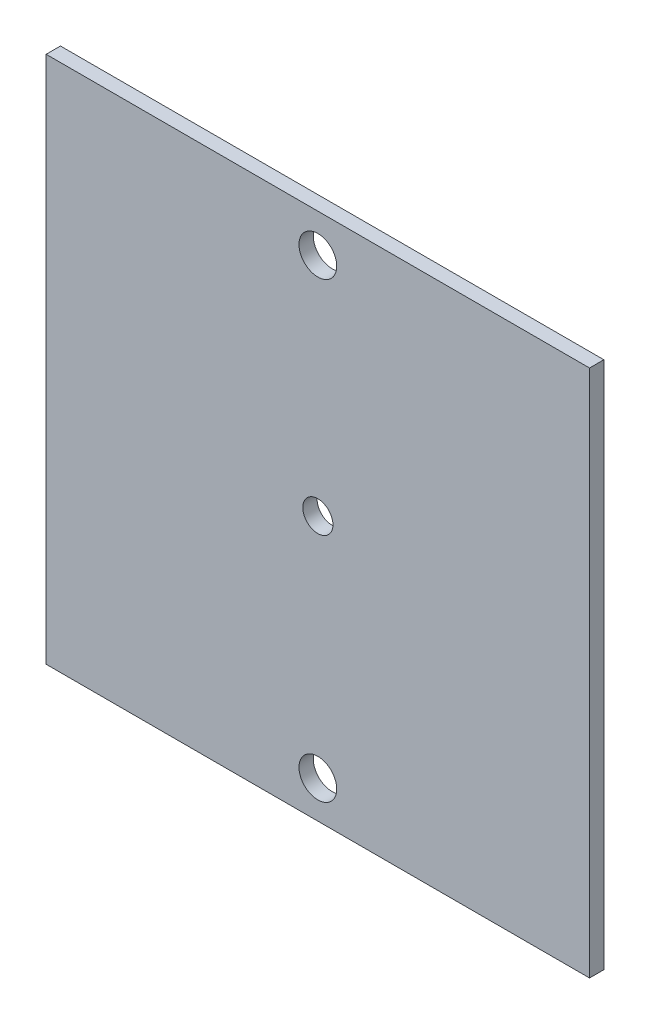
from build123d import *

# Parameters (mm, degrees)
SKETCH1_W          = 72
SKETCH1_H          = 70
BASE_FLANGE1_DEPTH = 1.89738
SKETCH6_R          = 2.5
SKETCH6_R_2        = 2
CUT_EXTRUDE1_DEPTH = 2


# Sheet-metal steps are written as plain solids
with BuildPart() as part:
    # Sketch1 → Base-Flange1 (new body)
    with BuildSketch(Plane.XY):
        with Locations((2.352272727, 30.691243667)):
            Rectangle(SKETCH1_W, SKETCH1_H)
    extrude(amount=-BASE_FLANGE1_DEPTH)

    # Sketch6 → Cut-Extrude1 (cut)
    with BuildSketch(Plane.XY):
        with Locations((2.354647746, 60.626948244)):
            Circle(SKETCH6_R)
        with Locations((2.354647746, 0.626948244)):
            Circle(SKETCH6_R)
        with Locations((2.354647746, 30.691243667)):
            Circle(SKETCH6_R_2)
    extrude(amount=-CUT_EXTRUDE1_DEPTH, mode=Mode.SUBTRACT)


solid = part.part
